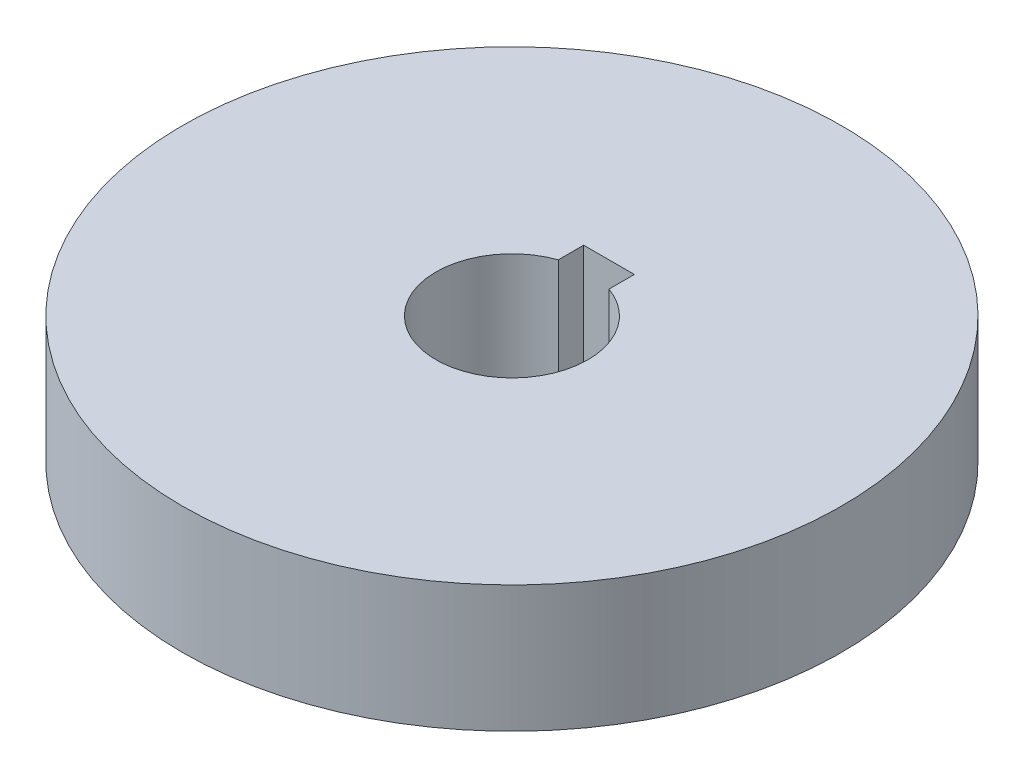
from build123d import *

# Parameters (mm, degrees)
SKETCH1_R           = 26
SKETCH1_R_2         = 6
BOSS_EXTRUDE1_DEPTH = 10
CUT_EXTRUDE1_DEPTH  = 39.105117767


with BuildPart() as part:
    # Sketch1 → Boss-Extrude1 (new body)
    with BuildSketch(Plane(origin=(0, 0, 0), x_dir=(1, 0, 0), z_dir=(0, 1, 0))):
        Circle(SKETCH1_R)
        Circle(SKETCH1_R_2, mode=Mode.SUBTRACT)
    extrude(amount=BOSS_EXTRUDE1_DEPTH)

    # Sketch2 → Cut-Extrude1 (cut, through all)
    with BuildSketch(Plane(origin=(0, 10, 0), x_dir=(1, 0, 0), z_dir=(0, 1, 0))):
        with BuildLine():
            Line((2, 5.656854249), (2, 7.656854249))
            Line((2, 7.656854249), (-2, 7.656854249))
            Line((-2, 7.656854249), (-2, 5.656854249))
            ThreePointArc((-2, 5.656854249), (0, 6), (2, 5.656854249))
        make_face()
    extrude(amount=-CUT_EXTRUDE1_DEPTH, mode=Mode.SUBTRACT)


solid = part.part
